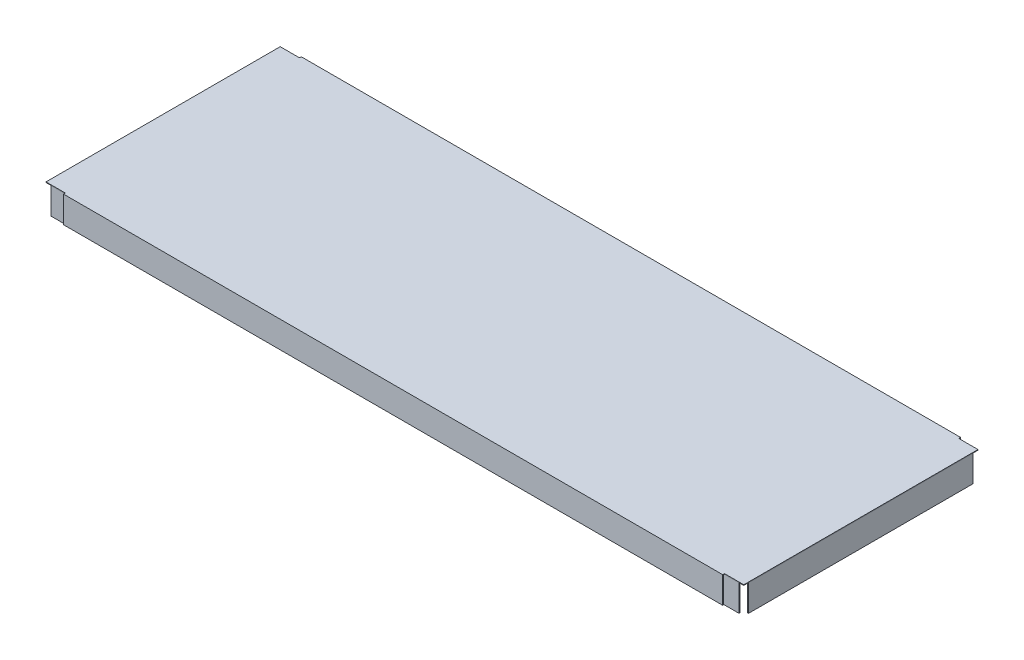
from build123d import *

# Parameters (mm, degrees)
SKETCH1_W                  = 1835.15
SKETCH1_H                  = 615.95
BOSS_EXTRUDE1_DEPTH        = 1.5875
BOSS_EXTRUDE2_DEPTH        = 866.775
BOSS_EXTRUDE3_DEPTH        = 904.875
BOSS_EXTRUDE3_DEPTH_BACK   = 904.875
BOSS_EXTRUDE3_2_DEPTH      = 904.875
BOSS_EXTRUDE3_2_DEPTH_BACK = 904.875
BOSS_EXTRUDE4_DEPTH        = 295.275
BOSS_EXTRUDE4_DEPTH_BACK   = 295.275
BOSS_EXTRUDE4_2_DEPTH      = 295.275
BOSS_EXTRUDE4_2_DEPTH_BACK = 295.275
CUT_EXTRUDE1_START         = -3.96875
CUT_EXTRUDE1_DEPTH         = 2.38125
CUT_EXTRUDE1_2_DEPTH       = 2.38125
CUT_EXTRUDE1_3_DEPTH       = 2.38125
CUT_EXTRUDE1_4_DEPTH       = 2.38125
BOSS_EXTRUDE5_START        = -305.59375
BOSS_EXTRUDE5_DEPTH        = 611.1875
SKETCH9_W                  = 28.575
SKETCH9_H                  = 12.7
CUT_EXTRUDE2_DEPTH         = 1281.6658763


# Read off the part's stored shape, not the designer's step: Cut-Extrude1, Boss-Extrude5
with BuildPart() as part:
    # Sketch1 → Boss-Extrude1 (new body)
    with BuildSketch(Plane(origin=(0, 0, 0), x_dir=(1, 0, 0), z_dir=(0, 1, 0))):
        Rectangle(SKETCH1_W, SKETCH1_H)
    extrude(amount=-BOSS_EXTRUDE1_DEPTH)

    # Sketch2 → Boss-Extrude2 (add, symmetric)
    with BuildSketch(Plane(origin=(0, 0, 0), x_dir=(0, 0, -1), z_dir=(1, 0, 0))):
        Polygon((-311.15, -1.5875), (311.15, -1.5875), (311.15, -69.85), (312.7375, -69.85), (312.7375, 0), (-312.7375, 0), (-312.7375, -69.85), (-311.15, -69.85), align=None)
    extrude(amount=BOSS_EXTRUDE2_DEPTH, both=True)


with BuildPart() as body_2:
    # Sketch3 → Boss-Extrude3 (new, two sides: drawn at the far end of the back side and taken through both)
    with BuildSketch(Plane(origin=(0, 0, 0), x_dir=(0, 0, -1), z_dir=(1, 0, 0)).offset(-BOSS_EXTRUDE3_DEPTH_BACK)):
        Polygon((307.975, -71.4375), (307.975, -1.5875), (282.575, -1.5875), (282.575, -3.96875), (305.59375, -3.96875), (305.59375, -71.4375), align=None)
    extrude(amount=BOSS_EXTRUDE3_DEPTH + BOSS_EXTRUDE3_DEPTH_BACK)

    # Cut-Extrude1 4 outline → Cut-Extrude1 4 (cut)
    with BuildSketch(Plane(origin=(0, 0, 0), x_dir=(1, 0, 0), z_dir=(0, 1, 0)).offset(CUT_EXTRUDE1_START)):
        Polygon((-904.875, 282.575), (-885.825, 282.575), (-904.875, 301.625), align=None)
        Polygon((904.875, 301.625), (885.825, 282.575), (904.875, 282.575), align=None)
    extrude(amount=CUT_EXTRUDE1_4_DEPTH, mode=Mode.SUBTRACT)


with BuildPart() as body_3:
    # Sketch3 → Boss-Extrude3 2 (new, two sides: drawn at the far end of the back side and taken through both)
    with BuildSketch(Plane(origin=(0, 0, 0), x_dir=(0, 0, -1), z_dir=(1, 0, 0)).offset(-BOSS_EXTRUDE3_2_DEPTH_BACK)):
        Polygon((-282.575, -1.5875), (-307.975, -1.5875), (-307.975, -71.4375), (-305.59375, -71.4375), (-305.59375, -3.96875), (-282.575, -3.96875), align=None)
    extrude(amount=BOSS_EXTRUDE3_2_DEPTH + BOSS_EXTRUDE3_2_DEPTH_BACK)

    # Cut-Extrude1 3 outline → Cut-Extrude1 3 (cut)
    with BuildSketch(Plane(origin=(0, 0, 0), x_dir=(1, 0, 0), z_dir=(0, 1, 0)).offset(CUT_EXTRUDE1_START)):
        Polygon((-904.875, -282.575), (-904.875, -301.625), (-885.825, -282.575), align=None)
        Polygon((904.875, -282.575), (885.825, -282.575), (904.875, -301.625), align=None)
    extrude(amount=CUT_EXTRUDE1_3_DEPTH, mode=Mode.SUBTRACT)


with BuildPart() as body_4:
    # Sketch4 → Boss-Extrude4 (new, two sides: drawn at the far end of the back side and taken through both)
    with BuildSketch(Plane.XY.offset(-BOSS_EXTRUDE4_DEPTH_BACK)):
        Polygon((892.175, -1.5875), (917.575, -1.5875), (917.575, -71.4375), (915.19375, -71.4375), (915.19375, -3.96875), (892.175, -3.96875), align=None)
    extrude(amount=BOSS_EXTRUDE4_DEPTH + BOSS_EXTRUDE4_DEPTH_BACK)

    # Cut-Extrude1 2 outline → Cut-Extrude1 2 (cut)
    with BuildSketch(Plane(origin=(0, 0, 0), x_dir=(1, 0, 0), z_dir=(0, 1, 0)).offset(CUT_EXTRUDE1_START)):
        Polygon((892.175, 295.275), (892.175, 276.225), (911.225, 295.275), align=None)
        Polygon((911.225, -295.275), (892.175, -276.225), (892.175, -295.275), align=None)
    extrude(amount=CUT_EXTRUDE1_2_DEPTH, mode=Mode.SUBTRACT)


with BuildPart() as body_5:
    # Sketch4 → Boss-Extrude4 2 (new, two sides: drawn at the far end of the back side and taken through both)
    with BuildSketch(Plane.XY.offset(-BOSS_EXTRUDE4_2_DEPTH_BACK)):
        Polygon((-917.575, -1.5875), (-917.575, -71.4375), (-915.19375, -71.4375), (-915.19375, -3.96875), (-892.175, -3.96875), (-892.175, -1.5875), align=None)
    extrude(amount=BOSS_EXTRUDE4_2_DEPTH + BOSS_EXTRUDE4_2_DEPTH_BACK)

    # Cut-Extrude1 outline → Cut-Extrude1 (cut)
    with BuildSketch(Plane(origin=(0, 0, 0), x_dir=(1, 0, 0), z_dir=(0, 1, 0)).offset(CUT_EXTRUDE1_START)):
        Polygon((-892.175, 295.275), (-911.225, 295.275), (-892.175, 276.225), align=None)
        Polygon((-892.175, -295.275), (-892.175, -276.225), (-911.225, -295.275), align=None)
    extrude(amount=CUT_EXTRUDE1_DEPTH, mode=Mode.SUBTRACT)


with BuildPart() as body_6:
    # Boss-Extrude5 outline → Boss-Extrude5 (new body)
    with BuildSketch(Plane.XY.offset(BOSS_EXTRUDE5_START)):
        Polygon((-296.8625, -71.4375), (-296.8625, -1.5875), (-322.2625, -1.5875), (-322.2625, -3.96875), (-299.24375, -3.96875), (-299.24375, -71.4375), align=None)
        Polygon((322.2625, -1.5875), (296.8625, -1.5875), (296.8625, -71.4375), (299.24375, -71.4375), (299.24375, -3.96875), (322.2625, -3.96875), align=None)
    extrude(amount=BOSS_EXTRUDE5_DEPTH)

    # Sketch9 → Cut-Extrude2 (cut, through all)
    with BuildSketch(Plane(origin=(322.2625, 0, 0), x_dir=(0, 0, -1), z_dir=(1, 0, 0))):
        with Locations((-291.30625, -7.9375)):
            Rectangle(SKETCH9_W, SKETCH9_H)
        with Locations((291.30625, -7.9375)):
            Rectangle(SKETCH9_W, SKETCH9_H)
    extrude(amount=-CUT_EXTRUDE2_DEPTH, mode=Mode.SUBTRACT)


solid = Compound([part.part, body_2.part, body_3.part, body_4.part, body_5.part, body_6.part])
